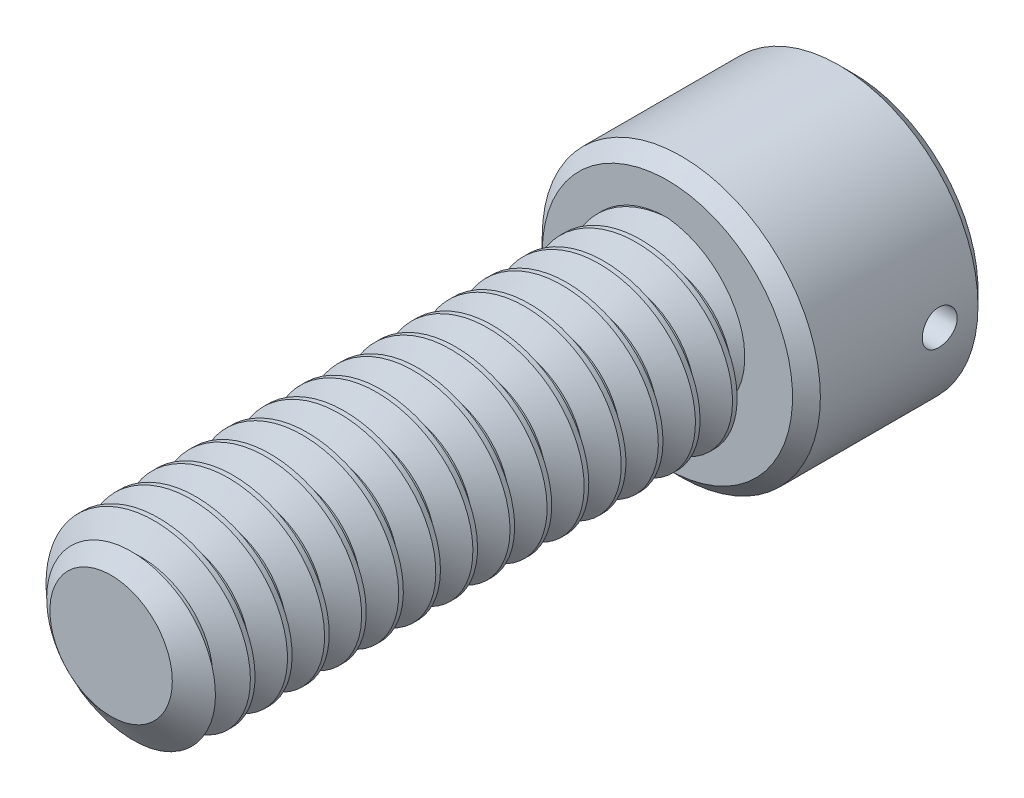
from build123d import *

# Parameters (mm, degrees)
SKETCH1_R               = 3.175
EXTRUDE1_DEPTH          = 19.05
CUT_SWEEP1_PITCH        = 1.27
SKETCH6_R               = 4.7625
EXTRUDE2_DEPTH          = 6.35
CUT_EXTRUDE1_DEPTH      = 3.571875
CHAMFER1_SIZE           = 0.47625
CUT_EXTRUDE3_DEPTH      = 27.277800755
CUT_EXTRUDE3_DEPTH_BACK = 27.277800755
SKETCH12_R              = 0.5969


with BuildPart() as part:
    # Sketch1 → Extrude1 (new body)
    with BuildSketch(Plane.XY):
        Circle(SKETCH1_R)
    extrude(amount=-EXTRUDE1_DEPTH)

    # Cut-Sweep1: the profile of Sketch3 profile screwed along a right-hand helix of 16 turns, 6 arcs to a turn; built about Z, then put on its axis
    cut_sweep1_z = Axis((0, 0, 0), (0, 0, 1))
    cut_sweep1_corners = [(3.1753, 0, -1.111423205), (2.350110803, 0, -0.635), (2.350110803, 0, -0.47625), (3.1753, 0, 0.000173205)]
    with BuildLine(mode=Mode.PRIVATE) as cut_sweep1_profile:
        Line(cut_sweep1_corners[0], cut_sweep1_corners[1])
        Line(cut_sweep1_corners[1], cut_sweep1_corners[2])
        Line(cut_sweep1_corners[2], cut_sweep1_corners[3])
        Line(cut_sweep1_corners[3], cut_sweep1_corners[0])
    cut_sweep1_cap = Face(cut_sweep1_profile.wire())
    cut_sweep1_turn_angles = [0, 30, 60, 90, 120, 150, 180, 210, 240, 270, 300, 330, 360]
    cut_sweep1_turn_weights = [1, 0.8660254037844387, 1, 0.8660254037844387, 1, 0.8660254037844387, 1, 0.8660254037844387, 1, 0.8660254037844387, 1, 0.8660254037844387, 1]
    cut_sweep1_turn_rails = [Edge.make_bspline([Vector(p[0], p[1], 0).rotate(cut_sweep1_z, cut_sweep1_turn_angles[k]) / cut_sweep1_turn_weights[k] + Vector(0, 0, p[2] + CUT_SWEEP1_PITCH * cut_sweep1_turn_angles[k] / 360) for k in range(13)], [0, 0, 0, 1, 1, 2, 2, 3, 3, 4, 4, 5, 5, 6, 6, 6], 2, cut_sweep1_turn_weights) for p in cut_sweep1_corners]
    cut_sweep1_turn_sides = [Face.make_surface_from_curves(cut_sweep1_turn_rails[p[0]], cut_sweep1_turn_rails[p[1]]) for p in [(0, 1), (1, 2), (2, 3), (3, 0)]]
    cut_sweep1 = Plane(origin=(0, 0, 0), x_dir=(0, 1, 0), z_dir=(0, 0, -1)) * Solid(Shell([*[p.moved(Location((0, 0, CUT_SWEEP1_PITCH * i))) for i in range(16) for p in cut_sweep1_turn_sides], cut_sweep1_cap, cut_sweep1_cap.rotate(cut_sweep1_z, 5760).moved(Location((0, 0, CUT_SWEEP1_PITCH * 5760 / 360)))]))
    add(cut_sweep1, mode=Mode.SUBTRACT)

    # Sketch4 → Cut-Revolve1 (revolve, cut)
    with BuildSketch(Plane(origin=(0, 0, 0), x_dir=(0, 0, -1), z_dir=(1, 0, 0)), mode=Mode.PRIVATE) as cut_revolve1_sk:
        Polygon((0.755446349, 3.175), (0, 2.096110803), (0, 3.175), align=None)
    revolve(cut_revolve1_sk.sketch.rotate(Axis((0, 0, 0), (0, 0, -1)), 229.892048011), axis=Axis((0, 0, 0), (0, 0, -1)), mode=Mode.SUBTRACT)

    # Sketch6 → Extrude2 (add)
    with BuildSketch(Plane(origin=(0, 0, -19.05), x_dir=(-1, 0, 0), z_dir=(0, 0, -1))):
        Circle(SKETCH6_R)
    extrude(amount=EXTRUDE2_DEPTH)

    # Sketch7 → Cut-Extrude1 (cut)
    with BuildSketch(Plane(origin=(0, 0, -25.4), x_dir=(-1, 0, 0), z_dir=(0, 0, -1))):
        Polygon((0, 2.749630657), (-2.38125, 1.374815329), (-2.38125, -1.374815329), (0, -2.749630657), (2.38125, -1.374815329), (2.38125, 1.374815329), align=None)
    extrude(amount=-CUT_EXTRUDE1_DEPTH, mode=Mode.SUBTRACT)

    # Cut-Extrude2 cone 1 section (through the dimple's axis) → Cut-Extrude2 (revolve, cut)
    with BuildSketch(Plane(origin=(0, 0, -25.4), x_dir=(0, 1, 0), z_dir=(1, 0, 0))):
        Polygon((0, 0), (2.749630657, 0), (0, 2.749630657), align=None)
    revolve(axis=Axis((0, 0, -25.4), (0, 0, 1)), mode=Mode.SUBTRACT)

    # Chamfer1
    chamfer1_edges = [part.edges().sort_by_distance(p)[0] for p in [
        (4.7625, 0, -19.05),
        (4.7625, 0, -25.4),
    ]]
    chamfer(chamfer1_edges, length=CHAMFER1_SIZE)

    # Sketch12 → Cut-Extrude3 (cut, two sides: drawn at the far end of the back side and taken through both)
    with BuildSketch(Plane(origin=(0, 0, 0), x_dir=(0, 0, -1), z_dir=(1, 0, 0)).offset(-CUT_EXTRUDE3_DEPTH_BACK)):
        with Locations((23.6140625, 0)):
            Circle(SKETCH12_R)
    extrude(amount=CUT_EXTRUDE3_DEPTH + CUT_EXTRUDE3_DEPTH_BACK, mode=Mode.SUBTRACT)


solid = part.part
